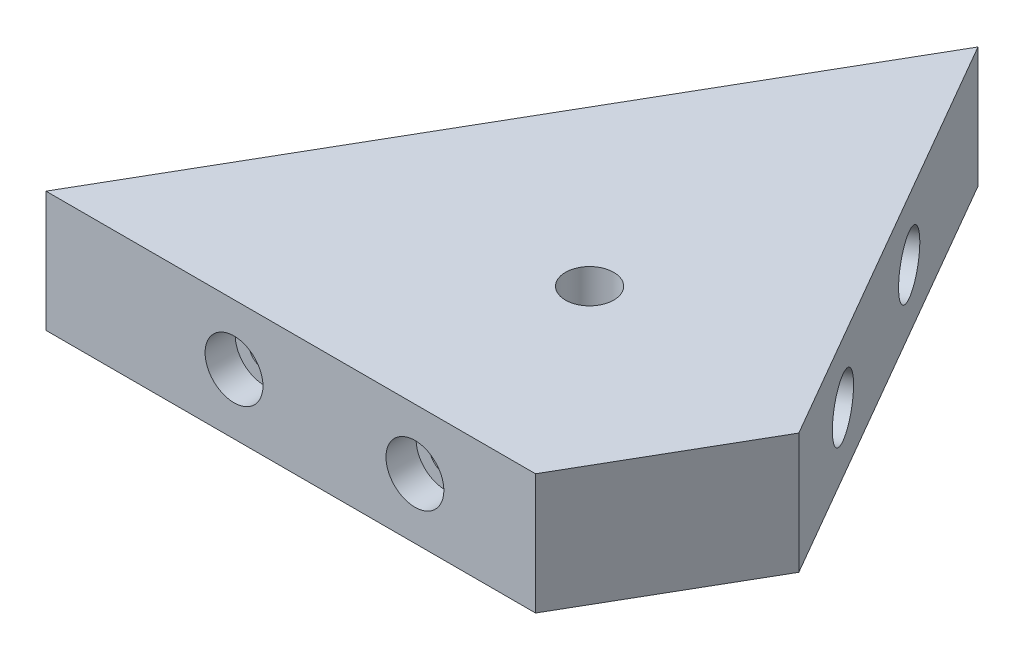
from build123d import *

# Parameters (mm, degrees)
BOSS_EXTRUDE1_DEPTH = 25.4
SKETCH2_R           = 6.096
CUT_EXTRUDE1_DEPTH  = 6.35
SKETCH3_R           = 3.2639
CUT_EXTRUDE2_DEPTH  = 16.51
SKETCH4_R           = 3.2639
CUT_EXTRUDE3_DEPTH  = 16.51
SKETCH5_R           = 5.08
CUT_EXTRUDE4_DEPTH  = 280.690442894


with BuildPart() as part:
    # Sketch1 → Boss-Extrude1 (new body)
    with BuildSketch(Plane(origin=(0, 0, 0), x_dir=(1, 0, 0), z_dir=(0, 1, 0))):
        Polygon((119.068292428, -241.162389864), (129.21607637, -223.585912492), (51.895065274, -178.944605922), (15.973610966, -241.162389864), align=None)
    boss_extrude1 = extrude(amount=BOSS_EXTRUDE1_DEPTH)

    # Sketch2 → Cut-Extrude1 (cut)
    with BuildSketch(Plane.XY.offset(241.162389864)):
        with Locations((55.568292428, 12.7)):
            Circle(SKETCH2_R)
        with Locations((93.668292428, 12.7)):
            Circle(SKETCH2_R)
    cut_extrude1 = extrude(amount=-CUT_EXTRUDE1_DEPTH, mode=Mode.SUBTRACT)

    # Sketch3 → Cut-Extrude2 (cut)
    with BuildSketch(Plane.XY.offset(234.812389864)):
        with Locations((55.568292428, 12.7)):
            Circle(SKETCH3_R)
    cut_extrude2 = extrude(amount=-CUT_EXTRUDE2_DEPTH, mode=Mode.SUBTRACT)

    # Sketch4 → Cut-Extrude3 (cut)
    with BuildSketch(Plane.XY.offset(234.812389864)):
        with Locations((93.668292428, 12.7)):
            Circle(SKETCH4_R)
    cut_extrude3 = extrude(amount=-CUT_EXTRUDE3_DEPTH, mode=Mode.SUBTRACT)

    # Mirror1: Boss-Extrude1, Cut-Extrude1, Cut-Extrude2, Cut-Extrude3 across plane
    add(boss_extrude1.mirror(Plane(origin=(51.895065274, 25.4, 178.944605922), x_dir=(0.8660254037844389, 0, 0.4999999999999996), z_dir=(-0.49999999999999983, 0, 0.8660254037844388))))
    add(cut_extrude1.mirror(Plane(origin=(51.895065274, 25.4, 178.944605922), x_dir=(0.8660254037844389, 0, 0.4999999999999996), z_dir=(-0.49999999999999983, 0, 0.8660254037844388))), mode=Mode.SUBTRACT)
    add(cut_extrude2.mirror(Plane(origin=(51.895065274, 25.4, 178.944605922), x_dir=(0.8660254037844389, 0, 0.4999999999999996), z_dir=(-0.49999999999999983, 0, 0.8660254037844388))), mode=Mode.SUBTRACT)
    add(cut_extrude3.mirror(Plane(origin=(51.895065274, 25.4, 178.944605922), x_dir=(0.8660254037844389, 0, 0.4999999999999996), z_dir=(-0.49999999999999983, 0, 0.8660254037844388))), mode=Mode.SUBTRACT)

    # Sketch5 → Cut-Extrude4 (cut, through all)
    with BuildSketch(Plane(origin=(0, 25.4, 0), x_dir=(1, 0, 0), z_dir=(0, 1, 0))):
        with Locations((90.555570822, -201.265259207)):
            Circle(SKETCH5_R)
    extrude(amount=-CUT_EXTRUDE4_DEPTH, mode=Mode.SUBTRACT)


solid = part.part
